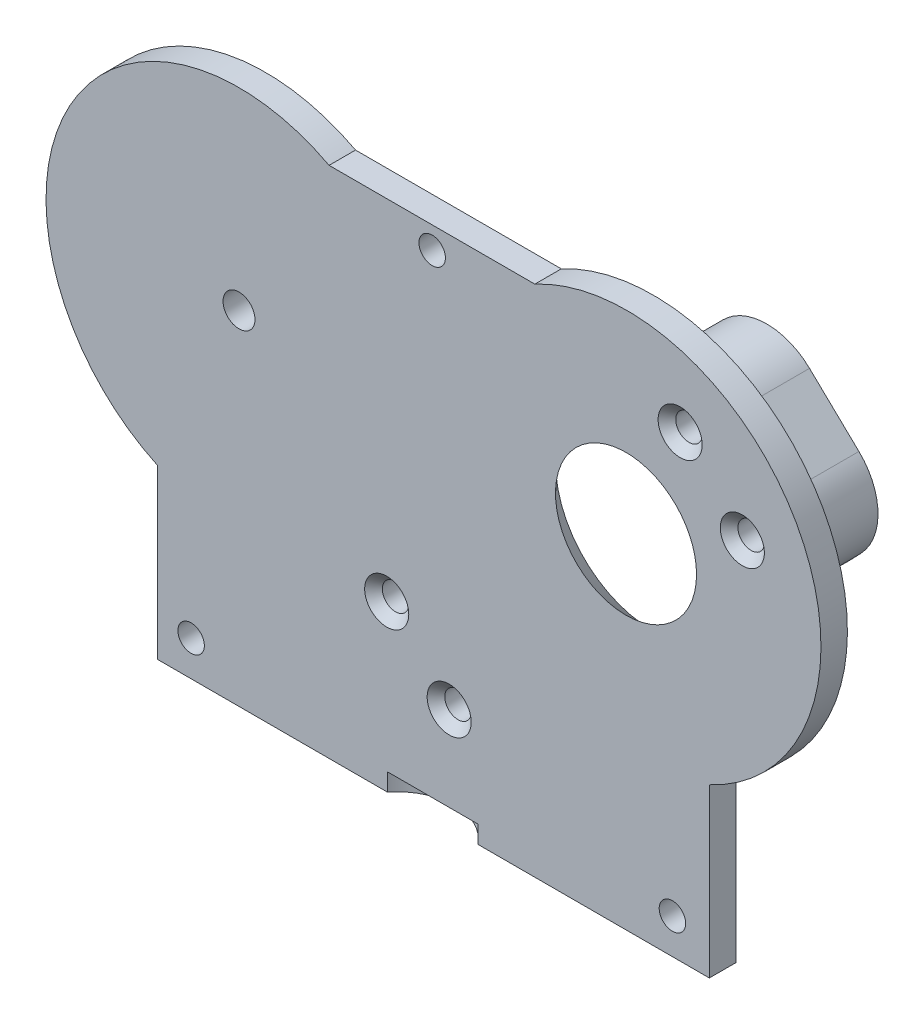
from build123d import *
from build123d.topology import SkipClean

# Parameters (mm, degrees)
CROQUIS1_R                          = 1.810063523
BASE_SOPORTE_DEPTH                  = 3
CAJEADO_SERVO_DEPTH                 = 3
SOPORTES_START                      = 11
SOPORTES_DEL_SERVO_DEPTH            = 11
SOPORTES_START_2                    = 3
CROQUIS4_R                          = 1.5
SOPORTES_TALADROS_SERVO_DEPTH       = 3
CROQUIS5_R                          = 1.5
TALADROS_TAPA_DEPTH                 = 3
RECTIFICACION_START                 = -3
CROQUIS6_R                          = 1.5
RECTIFICACION_TALADROS_SERVOS_DEPTH = 3
CROQUIS7_W                          = 24.98953617
CROQUIS7_H                          = 91.552769595
SUPRIMIR_SOPORTE_SERVO_DEPTH        = 27.15954006
RECTIFICACI_N_START                 = 7.5
CROQUIS8_R                          = 1.5
RECTIFICACI_N_SOPORTE_SERVO_DEPTH   = 7.5
REDONDEO_SOPORTE_SERVO_R            = 7
RECTIF_CAJA_SOPORTE_SERVO_DEPTH     = 2.5
RECTIFICACI_N_HUECO_SERVO_DEPTH     = 3
CHAFL_N_HUECO_SERVO_SIZE            = 4
CHAFL_N_TALADROS_SERVO_SIZE         = 1
CROQUIS11_R                         = 6.5
CAJA_SERVO_EXTERIOR_DEPTH           = 2


with BuildPart() as part:
    # Croquis1 → Base Soporte (new body)
    with BuildSketch(Plane.XY):
        with BuildLine():
            Line((11.548443784, 19.3588474), (-11.785521088, 19.3588474))
            ThreePointArc((-11.785521088, 19.3588474), (-41.605177571, 9.733322379), (-31.246229762, -19.839551086))
            Line((-31.246229762, -19.839551086), (-31.246229762, -38.896936565))
            Line((-31.246229762, -38.896936565), (31.339101257, -38.896936565))
            Line((31.339101257, -38.896936565), (31.339101257, -19.919367151))
            ThreePointArc((31.339101257, -19.919367151), (41.646982557, 9.899296763), (11.548443784, 19.3588474))
        make_face()
        with Locations((-22, 0)):
            Circle(CROQUIS1_R, mode=Mode.SUBTRACT)
        with Locations((22, 0)):
            Circle(CROQUIS1_R, mode=Mode.SUBTRACT)
    extrude(amount=BASE_SOPORTE_DEPTH)

    # Croquis2 → Cajeado Servo (cut)
    with BuildSketch(Plane.XY.offset(3)):
        Polygon((-11.961214469, -18.364687339), (3.425103863, -33.751005671), (41.608870047, 4.432760513), (26.222551715, 19.819078845), align=None)
    extrude(amount=-CAJEADO_SERVO_DEPTH, mode=Mode.SUBTRACT)

    # Croquis3 → Soportes del Servo (add)
    with SkipClean():  # the faces are left unmerged after this step: merging them gives an invalid solid
        with BuildSketch(Plane(origin=(0, 0, 0), x_dir=(-1, 0, 0), z_dir=(0, 0, -1)).offset(SOPORTES_START)):
            with BuildLine():
                Line((-41.608870047, 4.432760513), (-26.222551715, 19.819078845))
                Line((-26.222551715, 19.819078845), (-21.626357638, 15.222884767))
                Line((-21.626357638, 15.222884767), (-19.717169328, 17.132073076))
                Line((-19.717169328, 17.132073076), (-24.448426462, 21.86333021))
                ThreePointArc((-24.448426462, 21.86333021), (-26.753551475, 21.480310714), (-29.005048716, 20.854958463))
                Line((-29.005048716, 20.854958463), (-42.854958463, 7.005048716))
                ThreePointArc((-42.854958463, 7.005048716), (-43.438696033, 4.937844916), (-43.818053681, 2.823567528))
                Line((-43.818053681, 2.823567528), (-38.921864279, -2.072621874))
                Line((-38.921864279, -2.072621874), (-37.01267597, -0.163433565))
                Line((-37.01267597, -0.163433565), (-41.608870047, 4.432760513))
            make_face()
            Polygon((9.2742087, -11.859304952), (7.365020391, -13.768493261), (11.961214469, -18.364687339), (-3.425103863, -33.751005671), (-8.021297941, -29.154811594), (-9.93048625, -31.063999903), (-3.425103863, -37.56938229), (15.779591087, -18.364687339), align=None)
        extrude(amount=-SOPORTES_DEL_SERVO_DEPTH)

    # Croquis4 → Soportes Taladros servo (add)
    # profile 1 of 2: a face of its own
    with SkipClean():  # the faces are left unmerged after this step: merging them gives an invalid solid
        with BuildSketch(Plane(origin=(0, 0, -11), x_dir=(-1, 0, 0), z_dir=(0, 0, -1)).offset(SOPORTES_START_2)):
            with BuildLine():
                Line((-34.001825112, 8.729393743), (-30.752863076, 11.811206448))
                ThreePointArc((-30.752863076, 11.811206448), (-28.560820678, 10.108105277), (-25.911729157, 10.937513248))
                Line((-25.911729157, 10.937513248), (-19.717169328, 17.132073076))
                Line((-19.717169328, 17.132073076), (-24.448426462, 21.86333021))
                ThreePointArc((-24.448426462, 21.86333021), (-26.753551475, 21.480310714), (-29.005048716, 20.854958463))
                Line((-29.005048716, 20.854958463), (-42.854958463, 7.005048716))
                ThreePointArc((-42.854958463, 7.005048716), (-43.438696033, 4.937844916), (-43.818053681, 2.823567528))
                Line((-43.818053681, 2.823567528), (-38.921864279, -2.072621874))
                Line((-38.921864279, -2.072621874), (-32.982796969, 3.866445436))
                ThreePointArc((-32.982796969, 3.866445436), (-32.176656499, 6.573614275), (-34.001825112, 8.729393743))
            make_face()
            with Locations((-35.081299471, 5.964947938)):
                Circle(CROQUIS4_R, mode=Mode.SUBTRACT)
            with Locations((-28.029021327, 13.054805418)):
                Circle(CROQUIS4_R, mode=Mode.SUBTRACT)
        # profile 2 of 2: a face of its own
        with BuildSketch(Plane(origin=(0, 0, -11), x_dir=(-1, 0, 0), z_dir=(0, 0, -1)).offset(SOPORTES_START_2)):
            Polygon((-9.93048625, -31.063999903), (9.2742087, -11.859304952), (15.779591087, -18.364687339), (-3.425103863, -37.56938229), align=None)
            with Locations((-1.836535735, -27.279815798)):
                Circle(CROQUIS4_R, mode=Mode.SUBTRACT)
            with Locations((5.248935605, -20.223151514)):
                Circle(CROQUIS4_R, mode=Mode.SUBTRACT)
        extrude(amount=-SOPORTES_TALADROS_SERVO_DEPTH)

    # Croquis5 → Taladros tapa (cut)
    with SkipClean():  # the faces are left unmerged after this step: merging them gives an invalid solid
        with BuildSketch(Plane.XY.offset(3)):
            with Locations((-0.093560971, 16.855940523)):
                Circle(CROQUIS5_R)
            with Locations((-27.432662228, -34.898583993)):
                Circle(CROQUIS5_R)
            with Locations((27.152668791, -34.898583993)):
                Circle(CROQUIS5_R)
        extrude(amount=-TALADROS_TAPA_DEPTH, mode=Mode.SUBTRACT)

    # Croquis6 → Rectificacion Taladros Servos (add)
    # profile 1 of 2: a face of its own
    with SkipClean():  # the faces are left unmerged after this step: merging them gives an invalid solid
        with BuildSketch(Plane.XY.offset(3).offset(RECTIFICACION_START)):
            Polygon((-7.161735598, -13.565208469), (-11.961214469, -18.364687339), (3.425103863, -33.751005671), (8.224582734, -28.951526801), align=None)
            with Locations(Location((-5.248935605, -20.223151514, 0), (0, 0, 180))):
                Circle(CROQUIS6_R, mode=Mode.SUBTRACT)
            with Locations(Location((1.836535735, -27.279815798, 0), (0, 0, 180))):
                Circle(CROQUIS6_R, mode=Mode.SUBTRACT)
        # profile 2 of 2: a face of its own
        with BuildSketch(Plane.XY.offset(3).offset(RECTIFICACION_START)):
            Polygon((26.222551715, 19.819078845), (21.460424994, 15.056952123), (36.846743326, -0.329366209), (41.608870047, 4.432760513), align=None)
            with Locations(Location((35.081299471, 5.964947938, 0), (0, 0, 180))):
                Circle(CROQUIS6_R, mode=Mode.SUBTRACT)
            with Locations(Location((28.029021327, 13.054805418, 0), (0, 0, 180))):
                Circle(CROQUIS6_R, mode=Mode.SUBTRACT)
        extrude(amount=RECTIFICACION_TALADROS_SERVOS_DEPTH)

    # Croquis7 → Suprimir soporte servo (cut)
    with BuildSketch(Plane(origin=(20.497243077, -20.497243077, 0), x_dir=(0, 0, -1), z_dir=(0.7071067811865521, -0.7071067811865429, 0))):
        with Locations((12.494768085, -3.822323765)):
            Rectangle(CROQUIS7_W, CROQUIS7_H)
    extrude(amount=-SUPRIMIR_SOPORTE_SERVO_DEPTH, mode=Mode.SUBTRACT)

    # Croquis8 → Rectificación Soporte servo (add)
    # profile 1 of 2: a face of its own
    with SkipClean():  # the faces are left unmerged after this step: merging them gives an invalid solid
        with BuildSketch(Plane(origin=(0, 0, 0), x_dir=(-1, 0, 0), z_dir=(0, 0, -1)).offset(RECTIFICACI_N_START)):
            Polygon((-42.864863197, 5.964947938), (-27.141308886, 20.998553257), (-21.460424994, 15.056952123), (-36.846743326, -0.329366209), align=None)
            with Locations(Location((-35.081299471, 5.964947938, 0), (0, 0, 180))):
                Circle(CROQUIS8_R, mode=Mode.SUBTRACT)
            with Locations(Location((-28.029021327, 13.054805418, 0), (0, 0, 180))):
                Circle(CROQUIS8_R, mode=Mode.SUBTRACT)
        # profile 2 of 2: a face of its own
        with BuildSketch(Plane(origin=(0, 0, 0), x_dir=(-1, 0, 0), z_dir=(0, 0, -1)).offset(RECTIFICACI_N_START)):
            Polygon((7.161735598, -13.565208469), (-8.224582734, -28.951526801), (-1.836535735, -35.63274543), (13.887018575, -20.59914011), align=None)
            with Locations(Location((-1.836535735, -27.279815798, 0), (0, 0, 180))):
                Circle(CROQUIS8_R, mode=Mode.SUBTRACT)
            with Locations(Location((5.248935605, -20.223151514, 0), (0, 0, 180))):
                Circle(CROQUIS8_R, mode=Mode.SUBTRACT)
        extrude(amount=-RECTIFICACI_N_SOPORTE_SERVO_DEPTH)

    # Redondeo soporte servo
    redondeo_soporte_servo_edges = [part.edges().sort_by_distance(p)[0] for p in [
        (-13.887018575, -20.59914011, -3.75),
        (1.836535735, -35.63274543, -3.75),
        (42.864863197, 5.964947938, -3.75),
        (27.141308886, 20.998553257, -3.75),
    ]]
    fillet(redondeo_soporte_servo_edges, radius=REDONDEO_SOPORTE_SERVO_R)

    # Croquis9 → Rectif caja soporte servo (cut)
    with BuildSketch(Plane(origin=(0, 0, -7.5), x_dir=(-1, 0, 0), z_dir=(0, 0, -1))):
        Polygon((-34.810438409, 11.606433644), (-33.396224847, 13.020647207), (-28.446477378, 8.070899738), (-29.860690941, 6.656686176), align=None)
        Polygon((0.175683213, -20.551260854), (5.125430682, -25.501008322), (3.711217119, -26.915221884), (-1.238530349, -21.965474416), align=None)
    extrude(amount=-RECTIF_CAJA_SOPORTE_SERVO_DEPTH, mode=Mode.SUBTRACT)

    # Croquis10 → Rectificación  hueco servo (add)
    with SkipClean():  # the faces are left unmerged after this step: merging them gives an invalid solid
        with BuildSketch(Plane.XY.offset(3)):
            with BuildLine():
                Line((14.888375897, 0.004424428), (6.407897299, 0.004424428))
                Line((6.407897299, 0.004424428), (-7.161735598, -13.565208469))
                Line((-7.161735598, -13.565208469), (8.224582734, -28.951526801))
                Line((8.224582734, -28.951526801), (36.846743326, -0.329366209))
                Line((36.846743326, -0.329366209), (36.512952689, 0.004424428))
                Line((36.512952689, 0.004424428), (28.888375897, 0.004424428))
                ThreePointArc((28.888375897, 0.004424428), (21.888375897, -6.995575572), (14.888375897, 0.004424428))
            make_face()
            with BuildLine():
                Line((21.460424994, 15.056952123), (6.407897299, 0.004424428))
                Line((6.407897299, 0.004424428), (14.888375897, 0.004424428))
                ThreePointArc((14.888375897, 0.004424428), (21.888375897, 7.004424428), (28.888375897, 0.004424428))
                Line((28.888375897, 0.004424428), (36.512952689, 0.004424428))
                Line((36.512952689, 0.004424428), (21.460424994, 15.056952123))
            make_face()
        extrude(amount=-RECTIFICACI_N_HUECO_SERVO_DEPTH)
    add(part.part.scale(1), mode=Mode.REPLACE)  # the faces are merged on a copy

    # Chaflán hueco servo
    # the kernel refuses this chamfer: 4 mm, written as the material it takes off along each edge
    with BuildSketch(Plane(origin=(21.888375897, 0.004424428, 0), x_dir=(1, 0, 0), z_dir=(0, 1, 0))) as chafl_n_hueco_servo_piece_1_section:
        Polygon((7 + CHAFL_N_HUECO_SERVO_SIZE, 0), (7, -CHAFL_N_HUECO_SERVO_SIZE), (7, 0), align=None)
    chafl_n_hueco_servo_piece_1 = revolve(axis=Axis((21.888375897, 0.004424428, 0), (0, 0, -1)), mode=Mode.PRIVATE)
    chafl_n_hueco_servo_piece_1 = split(chafl_n_hueco_servo_piece_1, bisect_by=Plane(origin=(24.727929701, 11.789447416, 1.945469183), z_dir=(-0.7071067811865429, -0.7071067811865521, 0)), keep=Keep.TOP, mode=Mode.PRIVATE)
    add(chafl_n_hueco_servo_piece_1, mode=Mode.SUBTRACT)

    # Chaflán Taladros servo
    chafl_n_taladros_servo_edges = [part.edges().sort_by_distance(p)[0] for p in [
        (36.581299471, 5.964947938, 3),
        (29.529021327, 13.054805418, 3),
        (-3.748935605, -20.223151514, 3),
        (3.336535735, -27.279815798, 3),
    ]]
    chamfer(chafl_n_taladros_servo_edges, length=CHAFL_N_TALADROS_SERVO_SIZE)

    # Croquis11 → Caja servo exterior (cut)
    with BuildSketch(Plane.XZ.offset(38.896936565)):
        with Locations((-0.047423734, 7)):
            Circle(CROQUIS11_R)
    extrude(amount=-CAJA_SERVO_EXTERIOR_DEPTH, mode=Mode.SUBTRACT)


solid = part.part
